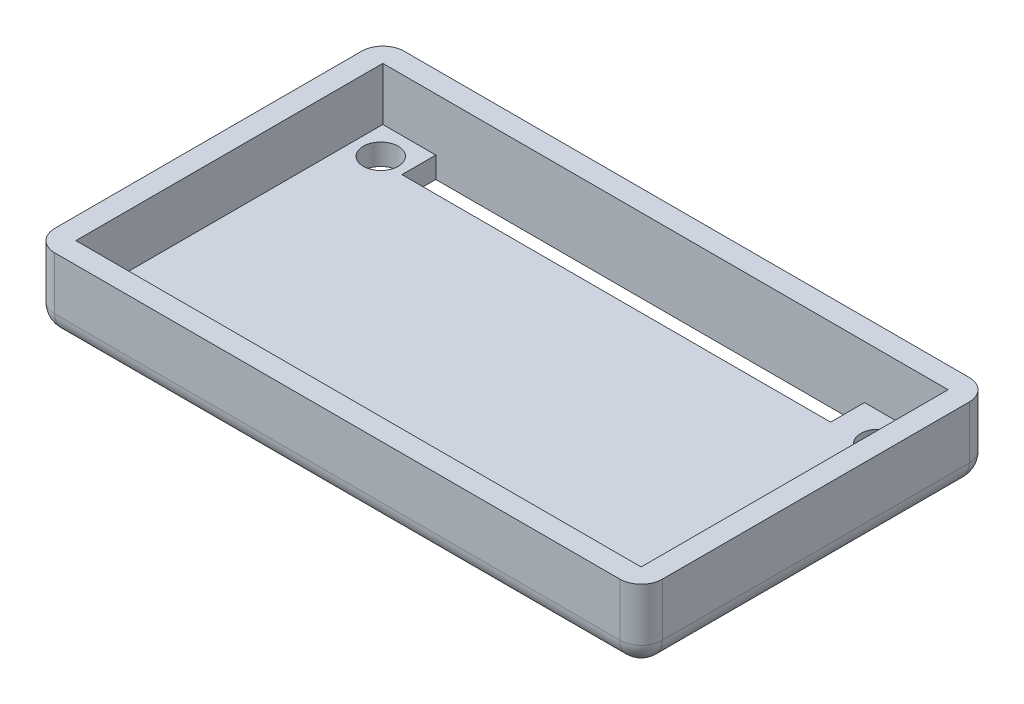
from build123d import *

# Parameters (mm, degrees)
SKETCH1_W           = 57.4
SKETCH1_H           = 33
BOSS_EXTRUDE1_DEPTH = 7
FILLET1_R           = 2
SHELL3_START        = 2
SHELL3_OUTLINE_W    = 5
SHELL3_OUTLINE_H    = 29
SHELL3_DEPTH        = 53.4
SKETCH2_R           = 1.65
CUT_EXTRUDE1_DEPTH  = 67.398493959
SKETCH3_W           = 40.5
SKETCH3_H           = 3.2
CUT_EXTRUDE2_DEPTH  = 67.398493959


# Read off the part's stored shape, not the designer's step: Shell3
with BuildPart() as part:
    # Sketch1 → Boss-Extrude1 (new body)
    with BuildSketch(Plane(origin=(0, 0, 0), x_dir=(1, 0, 0), z_dir=(0, 1, 0))):
        with Locations((28.7, 16.5)):
            Rectangle(SKETCH1_W, SKETCH1_H)
    extrude(amount=BOSS_EXTRUDE1_DEPTH)

    # Fillet1
    fillet1_edges = [part.edges().sort_by_distance(p)[0] for p in [
        (28.7, 0, -33),
        (57.4, 0, -16.5),
        (28.7, 0, 0),
        (0, 0, -16.5),
        (0, 3.5, -33),
        (57.4, 3.5, -33),
        (57.4, 3.5, 0),
        (0, 3.5, 0),
    ]]
    fillet(fillet1_edges, radius=FILLET1_R)

    # Shell3 outline → Shell3 (cut)
    with BuildSketch(Plane.YZ.offset(SHELL3_START)):
        with Locations((4.5, -16.5)):
            Rectangle(SHELL3_OUTLINE_W, SHELL3_OUTLINE_H)
    extrude(amount=SHELL3_DEPTH, mode=Mode.SUBTRACT)

    # Sketch2 → Cut-Extrude1 (cut, through all)
    with BuildSketch(Plane(origin=(0, 2, 0), x_dir=(1, 0, 0), z_dir=(0, 1, 0))):
        with Locations(Location((4.5, 28.3, 0), (0, 0, 270))):
            Circle(SKETCH2_R)
        with Locations(Location((51.5, 28.3, 0), (0, 0, 270))):
            Circle(SKETCH2_R)
        with Locations(Location((4.5, 4.7, 0), (0, 0, 270))):
            Circle(SKETCH2_R)
        with Locations(Location((51.5, 4.7, 0), (0, 0, 270))):
            Circle(SKETCH2_R)
    extrude(amount=-CUT_EXTRUDE1_DEPTH, mode=Mode.SUBTRACT)

    # Sketch3 → Cut-Extrude2 (cut, through all)
    with BuildSketch(Plane(origin=(0, 2, 0), x_dir=(1, 0, 0), z_dir=(0, 1, 0))):
        with Locations((27.25, 29.4)):
            Rectangle(SKETCH3_W, SKETCH3_H)
        with Locations((27.25, 3.6)):
            Rectangle(SKETCH3_W, SKETCH3_H)
    extrude(amount=-CUT_EXTRUDE2_DEPTH, mode=Mode.SUBTRACT)


solid = part.part
